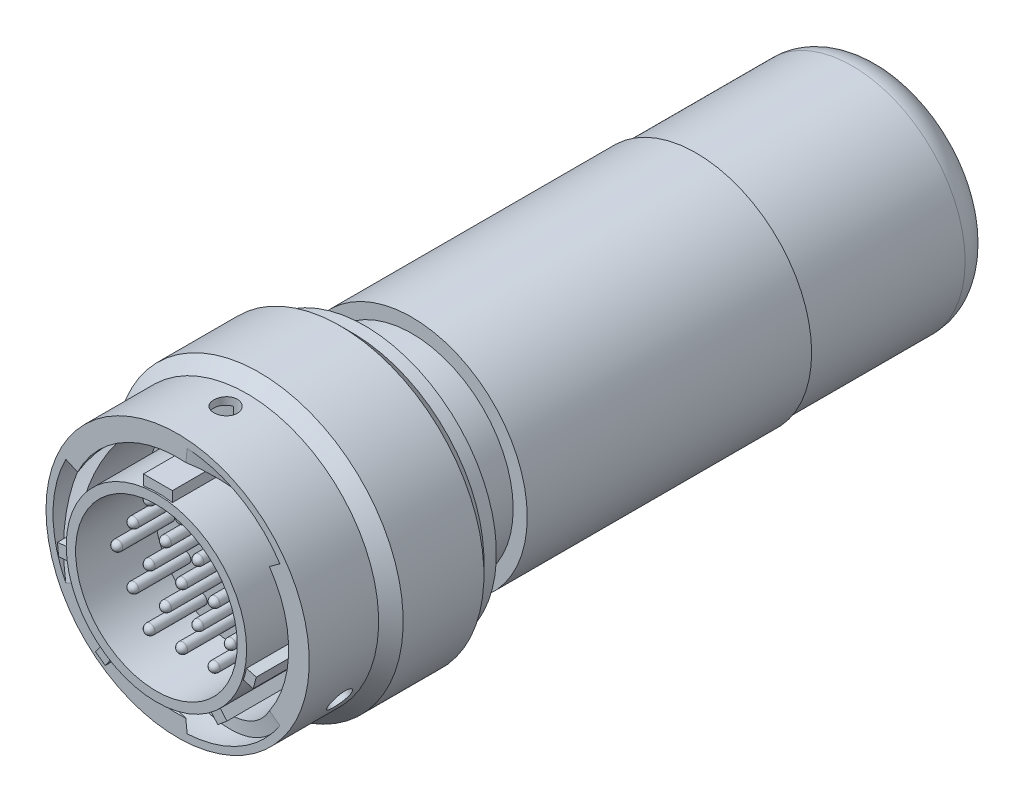
from build123d import *

# Parameters (mm, degrees)
SKETCH3_W                = 22.7718
SKETCH3_H                = 8.1407
BOSS_EXTRUDE1_START      = -9.2202
BOSS_EXTRUDE1_DEPTH      = 9.0678
SKETCH6_R                = 1.1938
CUT_EXTRUDE1_DEPTH       = 39.542119817
CUT_SWEEP1_PITCH         = 19.5072
CIRPATTERN1_COUNT        = 3
SKETCH14_19P_R           = 0.508
BOSS_EXTRUDE14_19P_DEPTH = 5.7912
FILLET14_19P_R           = 0.508


with BuildPart() as part:
    # Sketch3 → Revolve1 (revolve)
    with BuildSketch(Plane(origin=(0, 0, 0), x_dir=(0, 0, -1), z_dir=(1, 0, 0)), mode=Mode.PRIVATE) as revolve1_sk:
        Polygon((9.7282, 10.2235), (9.7282, 9.04875), (19.8, 9.04875), (21.07, 10.31875), (31.23, 10.31875), (32.5, 9.04875), (32.5, 8.2296), (0, 8.2296), (0, 9.1821), (9.2202, 9.1821), (9.2202, 10.2235), align=None)
        with Locations((19.3361, 4.07035)):
            Rectangle(SKETCH3_W, SKETCH3_H)
    revolve(revolve1_sk.sketch.rotate(Axis((0, 0, 0), (0, 0, -1)), 90), axis=Axis((0, 0, 0), (0, 0, -1)))

    # Sketch4 → Boss-Extrude1 (add)
    with BuildSketch(Plane.XY.offset(BOSS_EXTRUDE1_START)):
        with BuildLine():
            Line((-1.4732, 10.116799593), (1.4732, 10.116799593))
            Line((1.4732, 10.116799593), (1.4732, 9.063147476))
            ThreePointArc((1.4732, 9.063147476), (0, 9.1821), (-1.4732, 9.063147476))
            Line((-1.4732, 9.063147476), (-1.4732, 10.116799593))
        make_face()
        with BuildLine():
            Line((10.015348011, -2.052500052), (9.699795831, -3.230156819))
            Line((9.699795831, -3.230156819), (8.691883684, -2.960087573))
            ThreePointArc((8.691883684, -2.960087573), (8.86922753, -2.376502354), (9.007435863, -1.782430806))
            Line((9.007435863, -1.782430806), (10.015348011, -2.052500052))
        make_face()
        with BuildLine():
            Line((7.026827132, -7.425877235), (6.092865747, -8.209563888))
            Line((6.092865747, -8.209563888), (5.422137807, -7.410221455))
            ThreePointArc((5.422137807, -7.410221455), (5.902140111, -7.033896681), (6.356099192, -6.626534802))
            Line((6.356099192, -6.626534802), (7.026827132, -7.425877235))
        make_face()
        with BuildLine():
            Line((-5.354169915, -8.709352259), (-6.352880088, -8.010047868))
            Line((-6.352880088, -8.010047868), (-5.754371753, -7.155289382))
            ThreePointArc((-5.754371753, -7.155289382), (-5.266636196, -7.521535986), (-4.75566158, -7.854593773))
            Line((-4.75566158, -7.854593773), (-5.354169915, -8.709352259))
        make_face()
        with BuildLine():
            Line((-10.113344983, -1.496731609), (-10.219605264, -0.282171033))
            Line((-10.219605264, -0.282171033), (-9.180108534, -0.191226854))
            ThreePointArc((-9.180108534, -0.191226854), (-9.147159337, -0.800272745), (-9.073848253, -1.40578743))
            Line((-9.073848253, -1.40578743), (-10.113344983, -1.496731609))
        make_face()
    extrude(amount=BOSS_EXTRUDE1_DEPTH)

    # Sketch14-19P → Boss-Extrude14-19P (add)
    with BuildSketch(Plane.XY.offset(-7.9502)):
        with Locations(Location((0, 5.715, 0), (0, 0, 180))):
            Circle(SKETCH14_19P_R)
        with Locations(Location((3.302, 5.715, 0), (0, 0, 180))):
            Circle(SKETCH14_19P_R)
        with Locations(Location((4.953, 2.8702, 0), (0, 0, 180))):
            Circle(SKETCH14_19P_R)
        with Locations(Location((6.604, 0, 0), (0, 0, 180))):
            Circle(SKETCH14_19P_R)
        with Locations(Location((4.953, -2.8702, 0), (0, 0, 180))):
            Circle(SKETCH14_19P_R)
        with Locations(Location((3.302, -5.715, 0), (0, 0, 180))):
            Circle(SKETCH14_19P_R)
        with Locations(Location((0, -5.715, 0), (0, 0, 180))):
            Circle(SKETCH14_19P_R)
        with Locations(Location((-3.302, -5.715, 0), (0, 0, 180))):
            Circle(SKETCH14_19P_R)
        with Locations(Location((-4.953, -2.8702, 0), (0, 0, 180))):
            Circle(SKETCH14_19P_R)
        with Locations(Location((-6.604, 0, 0), (0, 0, 180))):
            Circle(SKETCH14_19P_R)
        with Locations(Location((-4.953, 2.8702, 0), (0, 0, 180))):
            Circle(SKETCH14_19P_R)
        with Locations(Location((-3.302, 5.715, 0), (0, 0, 180))):
            Circle(SKETCH14_19P_R)
        with Locations(Location((-1.651, 2.8702, 0), (0, 0, 180))):
            Circle(SKETCH14_19P_R)
        with Locations(Location((1.651, 2.8702, 0), (0, 0, 180))):
            Circle(SKETCH14_19P_R)
        with Locations(Location((3.302, 0, 0), (0, 0, 180))):
            Circle(SKETCH14_19P_R)
        with Locations(Location((1.651, -2.8702, 0), (0, 0, 180))):
            Circle(SKETCH14_19P_R)
        with Locations(Location((-1.651, -2.8702, 0), (0, 0, 180))):
            Circle(SKETCH14_19P_R)
        with Locations(Location((-3.302, 0, 0), (0, 0, 180))):
            Circle(SKETCH14_19P_R)
        with Locations(Location((0, 0, 0), (0, 0, 180))):
            Circle(SKETCH14_19P_R)
    extrude(amount=BOSS_EXTRUDE14_19P_DEPTH)

    # Fillet14-19P
    fillet14_19p_edges = [part.edges().sort_by_distance(p)[0] for p in [
        (3.81, 5.715, -2.159),
        (5.461, 2.8702, -2.159),
        (7.112, 0, -2.159),
        (5.461, -2.8702, -2.159),
        (3.81, -5.715, -2.159),
        (0.508, -5.715, -2.159),
        (-2.794, -5.715, -2.159),
        (-4.445, -2.8702, -2.159),
        (-6.096, 0, -2.159),
        (-4.445, 2.8702, -2.159),
        (-2.794, 5.715, -2.159),
        (-1.143, 2.8702, -2.159),
        (2.159, 2.8702, -2.159),
        (3.81, 0, -2.159),
        (2.159, -2.8702, -2.159),
        (-1.143, -2.8702, -2.159),
        (-2.794, 0, -2.159),
        (0.508, 0, -2.159),
        (0.508, 5.715, -2.159),
    ]]
    fillet(fillet14_19p_edges, radius=FILLET14_19P_R)


with BuildPart() as body_2:
    # Sketch5 → Revolve2 (revolve)
    with BuildSketch(Plane(origin=(0, 0, 0), x_dir=(0, 0, -1), z_dir=(1, 0, 0)), mode=Mode.PRIVATE) as revolve2_sk:
        Polygon((2.159, 13.4), (2.159, 11.303), (17.399, 11.303), (17.399, 12.573), (21.209, 12.573), (21.209, 13.4), (19.939, 13.4), (18.689, 14.65), (10.4702, 14.65), (9.2202, 13.4), align=None)
    revolve(revolve2_sk.sketch.rotate(Axis((0, 0, -32.5), (0, 0, 1)), 90), axis=Axis((0, 0, -32.5), (0, 0, 1)))

    # Sketch6 → Cut-Extrude1 (cut, through all)
    with BuildSketch(Plane(origin=(0, 0, 0), x_dir=(1, 0, 0), z_dir=(0, 1, 0))):
        with Locations(Location((0, 7.0358, 0), (0, 0, 90))):
            Circle(SKETCH6_R)
    cut_extrude1 = extrude(amount=CUT_EXTRUDE1_DEPTH, mode=Mode.SUBTRACT)

    # Cut-Sweep1: arcs per turn and ends read off the stored shape
    # Cut-Sweep1: the profile of Sketch8 screwed along a right-hand helix through 1.25 turns, 20 arcs to a turn; built about Z, then put on its axis
    cut_sweep1_z = Axis((0, 0, 0), (0, 0, 1))
    cut_sweep1_corners = [(11.222546706, 0.356563099, -20.80532064), (12.614518038, 0.356563099, -20.80532064), (12.614518038, -0.356563099, -18.20907936), (11.222546706, -0.356563099, -18.20907936)]
    with BuildLine(mode=Mode.PRIVATE) as cut_sweep1_profile:
        Line(cut_sweep1_corners[0], cut_sweep1_corners[1])
        Line(cut_sweep1_corners[2], cut_sweep1_corners[3])
        ThreePointArc((12.614518038, 0.356563099, -20.80532064), (12.686146766, 0, -19.5072), (12.614518038, -0.356563099, -18.20907936))
        ThreePointArc((11.222546706, -0.356563099, -18.20907936), (11.303, 0, -19.5072), (11.222546706, 0.356563099, -20.80532064))
    cut_sweep1_cap = Face(cut_sweep1_profile.wire())
    cut_sweep1_arcs = [((12.614518038, 0.356563099, -20.80532064), (12.758182222, 0, -19.5072), (12.614518038, -0.356563099, -18.20907936), (1, 0.9943537837433927, 1)), ((11.222546706, -0.356563099, -18.20907936), (11.384030056, 0, -19.5072), (11.222546706, 0.356563099, -20.80532064), (1, 0.992882129136328, 1))]  # start, shoulder, end, weights
    cut_sweep1_turn_angles = [0, 9, 18, 27, 36, 45, 54, 63, 72, 81, 90, 99, 108, 117, 126, 135, 144, 153, 162, 171, 180, 189, 198, 207, 216, 225, 234, 243, 252, 261, 270, 279, 288, 297, 306, 315, 324, 333, 342, 351, 360]
    cut_sweep1_turn_weights = [1, 0.9876883405951378, 1, 0.9876883405951378, 1, 0.9876883405951378, 1, 0.9876883405951378, 1, 0.9876883405951378, 1, 0.9876883405951378, 1, 0.9876883405951378, 1, 0.9876883405951378, 1, 0.9876883405951378, 1, 0.9876883405951378, 1, 0.9876883405951378, 1, 0.9876883405951378, 1, 0.9876883405951378, 1, 0.9876883405951378, 1, 0.9876883405951378, 1, 0.9876883405951378, 1, 0.9876883405951378, 1, 0.9876883405951378, 1, 0.9876883405951378, 1, 0.9876883405951378, 1]
    cut_sweep1_turn_rails = [Edge.make_bspline([Vector(p[0], p[1], 0).rotate(cut_sweep1_z, cut_sweep1_turn_angles[k]) / cut_sweep1_turn_weights[k] + Vector(0, 0, p[2] + CUT_SWEEP1_PITCH * cut_sweep1_turn_angles[k] / 360) for k in range(41)], [0, 0, 0, 1, 1, 2, 2, 3, 3, 4, 4, 5, 5, 6, 6, 7, 7, 8, 8, 9, 9, 10, 10, 11, 11, 12, 12, 13, 13, 14, 14, 15, 15, 16, 16, 17, 17, 18, 18, 19, 19, 20, 20, 20], 2, cut_sweep1_turn_weights) for p in cut_sweep1_corners]
    cut_sweep1_turn_sides = [*[Face.make_surface_from_curves(cut_sweep1_turn_rails[p[0]], cut_sweep1_turn_rails[p[1]]) for p in [(0, 1), (2, 3)]], *[Face.make_bezier_surface([[Vector(p[j][0], p[j][1], 0).rotate(cut_sweep1_z, cut_sweep1_turn_angles[2 * i + k]) / cut_sweep1_turn_weights[2 * i + k] + Vector(0, 0, p[j][2] + CUT_SWEEP1_PITCH * cut_sweep1_turn_angles[2 * i + k] / 360) for k in range(3)] for j in range(3)], [[p[3][j] * cut_sweep1_turn_weights[2 * i + k] for k in range(3)] for j in range(3)]) for p in cut_sweep1_arcs for i in range(20)]]
    cut_sweep1_last_angles = [360, 369, 378, 387, 396, 405, 414, 423, 432, 441, 450]
    cut_sweep1_last_weights = [1, 0.9876883405951378, 1, 0.9876883405951378, 1, 0.9876883405951378, 1, 0.9876883405951378, 1, 0.9876883405951378, 1]
    cut_sweep1_last_rails = [Edge.make_bspline([Vector(p[0], p[1], 0).rotate(cut_sweep1_z, cut_sweep1_last_angles[k]) / cut_sweep1_last_weights[k] + Vector(0, 0, p[2] + CUT_SWEEP1_PITCH * cut_sweep1_last_angles[k] / 360) for k in range(11)], [0, 0, 0, 1, 1, 2, 2, 3, 3, 4, 4, 5, 5, 5], 2, cut_sweep1_last_weights) for p in cut_sweep1_corners]
    cut_sweep1_last_sides = [*[Face.make_surface_from_curves(cut_sweep1_last_rails[p[0]], cut_sweep1_last_rails[p[1]]) for p in [(0, 1), (2, 3)]], *[Face.make_bezier_surface([[Vector(p[j][0], p[j][1], 0).rotate(cut_sweep1_z, cut_sweep1_last_angles[2 * i + k]) / cut_sweep1_last_weights[2 * i + k] + Vector(0, 0, p[j][2] + CUT_SWEEP1_PITCH * cut_sweep1_last_angles[2 * i + k] / 360) for k in range(3)] for j in range(3)], [[p[3][j] * cut_sweep1_last_weights[2 * i + k] for k in range(3)] for j in range(3)]) for p in cut_sweep1_arcs for i in range(5)]]
    cut_sweep1 = Plane(origin=(0, 0, -2.159), x_dir=(-1, 0, 0), z_dir=(0, 0, -1)) * Solid(Shell([*cut_sweep1_turn_sides, *cut_sweep1_last_sides, cut_sweep1_cap, cut_sweep1_cap.rotate(cut_sweep1_z, 450).moved(Location((0, 0, CUT_SWEEP1_PITCH * 450 / 360)))]))
    add(cut_sweep1, mode=Mode.SUBTRACT)

    # CirPattern1: Cut-Extrude1, Cut-Sweep1 ×3 about axis
    cirpattern1_axis = Axis((0, 0, -32.5), (0, 0, -1))
    add([cut_extrude1.rotate(cirpattern1_axis, i * 360 / CIRPATTERN1_COUNT) for i in range(1, CIRPATTERN1_COUNT)], mode=Mode.SUBTRACT)
    add([cut_sweep1.rotate(cirpattern1_axis, i * 360 / CIRPATTERN1_COUNT) for i in range(1, CIRPATTERN1_COUNT)], mode=Mode.SUBTRACT)


with BuildPart() as body_3:
    # Sketch9 → Revolve3 (revolve)
    with BuildSketch(Plane(origin=(0, 0, 0), x_dir=(0, 0, -1), z_dir=(1, 0, 0)), mode=Mode.PRIVATE) as revolve3_sk:
        with BuildLine():
            Line((26, 11.75), (26, 10.31875))
            Line((26, 10.31875), (70.825, 10.31875))
            ThreePointArc((70.825, 10.31875), (72.234794145, 9.734794145), (72.81875, 8.325))
            Line((72.81875, 8.325), (72.81875, 5.15))
            Line((72.81875, 5.15), (74, 5.15))
            Line((74, 5.15), (74, 8.325))
            ThreePointArc((74, 8.325), (73.07006403, 10.57006403), (70.825, 11.5))
            Line((70.825, 11.5), (54.95, 11.5))
            Line((54.95, 11.5), (54.95, 11.75))
            Line((54.95, 11.75), (26, 11.75))
        make_face()
    revolve(revolve3_sk.sketch.rotate(Axis((0, 0, 0), (0, 0, -1)), 90), axis=Axis((0, 0, 0), (0, 0, -1)))


solid = Compound([part.part, body_2.part, body_3.part])
